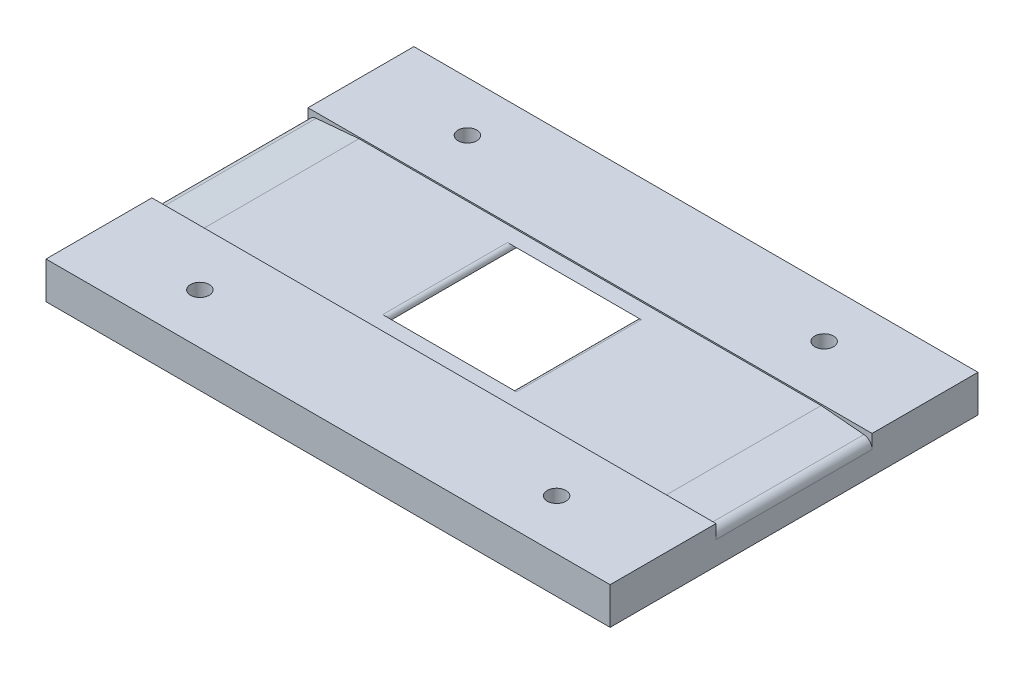
from build123d import *
from OCP.BRepFilletAPI import BRepFilletAPI_MakeChamfer

# Parameters (mm, degrees)
SKETCH_1_W               = 126.5
SKETCH_1_H               = 82.5
SKETCH_1_W_2             = 28
SKETCH_1_H_2             = 28
EXTRUDE_1_DEPTH          = 8
SKETCH_2_W               = 126.5
SKETCH_2_H               = 23.75
EXTRUDE_2_DEPTH          = 0.3
CHAMFER_1_SIZE           = 1
CHAMFER_1_SIZE2          = 11.430052303
FILLET_1_R               = 2
FILLET_2_R               = 1
CUT_EXTRUDE_1_DEPTH      = 76.935005103
CUT_EXTRUDE_1_DEPTH_BACK = 76.935005103
SKETCH_3_R               = 2.1
CHAMFER_2_SIZE           = 8.342275148
CHAMFER_2_SIZE_2         = 7
CHAMFER_3_SIZE2          = 8
CHAMFER_3_SIZE           = 9.534028741


with BuildPart() as part:
    # Эскиз1 → Бобышка-Вытянуть1 (new body)
    with BuildSketch(Plane(origin=(0, 0, 0), x_dir=(1, 0, 0), z_dir=(0, 1, 0))):
        Rectangle(SKETCH_1_W, SKETCH_1_H)
        Rectangle(SKETCH_1_W_2, SKETCH_1_H_2, mode=Mode.SUBTRACT)
    extrude(amount=EXTRUDE_1_DEPTH)

    # Эскиз2 → Бобышка-Вытянуть2 (add)
    with BuildSketch(Plane(origin=(0, 8, 0), x_dir=(1, 0, 0), z_dir=(0, 1, 0))):
        with Locations((0, 29.375)):
            Rectangle(SKETCH_2_W, SKETCH_2_H)
        with Locations((0, -29.375)):
            Rectangle(SKETCH_2_W, SKETCH_2_H)
    extrude(amount=EXTRUDE_2_DEPTH)

    # Фаска1: one chamfer whose edges measure the first distance from different faces: ONE call of the kernel's chamfer builder (chamfer() names one face for all edges)
    chamfer_1_edges_1 = [part.edges().sort_by_distance(p)[0] for p in [
        (-63.25, 8, 0),
    ]]
    chamfer_1_side_1 = [part.faces().sort_by_distance(p)[0] for p in [
        (-63.25, 4.087708565, 0),
    ]]
    chamfer_1_edges_2 = [part.edges().sort_by_distance(p)[0] for p in [
        (63.25, 8, 0),
    ]]
    chamfer_1_side_2 = [part.faces().sort_by_distance(p)[0] for p in [
        (63.25, 4.087708565, 0),
    ]]
    chamfer_1 = BRepFilletAPI_MakeChamfer(part.part.solid().wrapped)
    for e in chamfer_1_edges_1:
        chamfer_1.Add(CHAMFER_1_SIZE, CHAMFER_1_SIZE2, e.wrapped, chamfer_1_side_1[0].wrapped)  # the first distance lies on this face
    for e in chamfer_1_edges_2:
        chamfer_1.Add(CHAMFER_1_SIZE, CHAMFER_1_SIZE2, e.wrapped, chamfer_1_side_2[0].wrapped)  # the first distance lies on this face
    add(Compound.cast(chamfer_1.Shape()), mode=Mode.REPLACE)

    # Скругление1
    fillet_1_edges = [part.edges().sort_by_distance(p)[0] for p in [
        (63.25, 7, 0),
        (-63.25, 7, 0),
    ]]
    fillet(fillet_1_edges, radius=FILLET_1_R)

    # Скругление2
    fillet_2_edges = [part.edges().sort_by_distance(p)[0] for p in [
        (-14, 8, 0),
        (14, 8, 0),
    ]]
    fillet(fillet_2_edges, radius=FILLET_2_R)

    # Эскиз3 → Вырез-Вытянуть1 (cut, two sides: drawn at the far end of the back side and taken through both)
    with BuildSketch(Plane(origin=(0, 8, 0), x_dir=(1, 0, 0), z_dir=(0, 1, 0)).offset(-CUT_EXTRUDE_1_DEPTH_BACK)):
        with Locations(Location((-40, 30, 0), (0, 0, 270))):
            Circle(SKETCH_3_R)
        with Locations(Location((40, 30, 0), (0, 0, 270))):
            Circle(SKETCH_3_R)
        with Locations(Location((-40, -30, 0), (0, 0, 270))):
            Circle(SKETCH_3_R)
        with Locations(Location((40, -30, 0), (0, 0, 270))):
            Circle(SKETCH_3_R)
    extrude(amount=CUT_EXTRUDE_1_DEPTH + CUT_EXTRUDE_1_DEPTH_BACK, mode=Mode.SUBTRACT)

    # Фаска2
    chamfer_2_edges_1 = [part.edges().sort_by_distance(p)[0] for p in [
        (14, 0, 0),
    ]]
    chamfer_2_side_1 = [part.faces().sort_by_distance(p)[0] for p in [
        (14.14, 0, 0),
    ]]
    chamfer_2_edges_2 = [part.edges().sort_by_distance(p)[0] for p in [
        (-14, 0, 0),
    ]]
    chamfer_2_side_2 = [part.faces().sort_by_distance(p)[0] for p in [
        (-14.14, 0, 0),
    ]]
    chamfer_2 = BRepFilletAPI_MakeChamfer(part.part.solid().wrapped)
    for e in chamfer_2_edges_1:
        chamfer_2.Add(CHAMFER_2_SIZE - 0.0001, CHAMFER_2_SIZE_2 - 0.0001, e.wrapped, chamfer_2_side_1[0].wrapped)
    for e in chamfer_2_edges_2:
        chamfer_2.Add(CHAMFER_2_SIZE - 0.0001, CHAMFER_2_SIZE_2 - 0.0001, e.wrapped, chamfer_2_side_2[0].wrapped)
    add(Compound.cast(chamfer_2.Shape()), mode=Mode.REPLACE)  # a hair under: the kernel refuses the full size

    # Фаска3
    chamfer_3_edges = [part.edges().sort_by_distance(p)[0] for p in [
        (0, 0, -14),
    ]]
    chamfer_3_side = [part.faces().sort_by_distance(p)[0] for p in [
        (0, 0, -14.16),
    ]]
    chamfer(chamfer_3_edges, length=CHAMFER_3_SIZE - 0.0001, length2=CHAMFER_3_SIZE2 - 0.0001, reference=chamfer_3_side[0])  # a hair under: the kernel refuses the full size
    chamfer_3_2_edges = [part.edges().sort_by_distance(p)[0] for p in [
        (0, 0, 14),
    ]]
    chamfer_3_2_side = [part.faces().sort_by_distance(p)[0] for p in [
        (0, 0, 14.16),
    ]]
    chamfer(chamfer_3_2_edges, length=CHAMFER_3_SIZE - 0.0001, length2=CHAMFER_3_SIZE2 - 0.0001, reference=chamfer_3_2_side[0])  # a hair under: the kernel refuses the full size


solid = part.part
